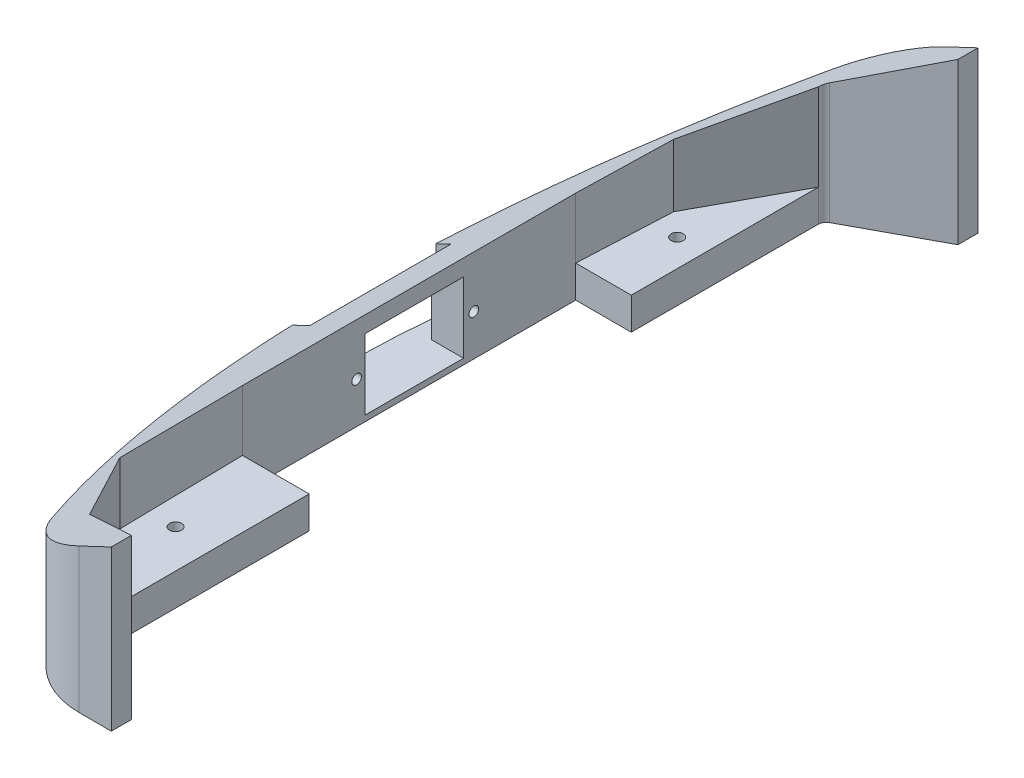
from build123d import *

# Parameters (mm, degrees)
FRONT_SKETCH_R      = 1.905
BOSS_EXTRUDE1_DEPTH = 50.8
CUT_EXTRUDE1_DEPTH  = 40.64
CUT_EXTRUDE2_DEPTH  = 320.68422056
CUT_EXTRUDE3_DEPTH  = 159.197793465
SKETCH6_W           = 6.524310643
SKETCH6_H           = 22.300846009
SKETCH6_R           = 1.524
SKETCH6_W_2         = 6.962786951
BOSS_EXTRUDE2_DEPTH = 10.16


with BuildPart() as part:
    # front_sketch → Boss-Extrude1 (new body)
    with BuildSketch(Plane(origin=(0, 0, 0), x_dir=(1, 0, 0), z_dir=(0, 1, 0))):
        with BuildLine():
            Line((-94.961375831, 124.478458264), (-121.345326632, 110.234521439))
            ThreePointArc((-121.345326632, 110.234521439), (-122.32001306, 109.300728329), (-122.678671172, 107.99944144))
            Line((-122.678671172, 107.99944144), (-122.678671172, 48.810796684))
            Line((-122.678671172, 48.810796684), (-140.250849959, 48.810796684))
            Line((-140.250849959, 48.810796684), (-140.250849959, -56.645199257))
            Line((-140.250849959, -56.645199257), (-119.167015715, -56.645199257))
            Line((-119.167015715, -56.645199257), (-119.167015715, -126.112255785))
            Line((-119.167015715, -126.112255785), (-95.601645083, -136.460242597))
            Line((-95.601645083, -136.460242597), (-95.601645083, -142.810242597))
            Line((-95.601645083, -142.810242597), (-105.798207048, -142.810242597))
            ThreePointArc((-105.798207048, -142.810242597), (-119.167015715, -139.007347839), (-128.532661201, -128.737404395))
            ThreePointArc((-128.532661201, -128.737404395), (-157.286213724, -5.861503432), (-127.918775374, 116.869125935))
            ThreePointArc((-127.918775374, 116.869125935), (-118.556014486, 127.058910858), (-105.241228699, 130.828458264))
            Line((-105.241228699, 130.828458264), (-94.961375831, 130.828458264))
            Line((-94.961375831, 130.828458264), (-94.961375831, 124.478458264))
        make_face()
        with Locations((-131.296368682, 71.963600743)):
            Circle(FRONT_SKETCH_R, mode=Mode.SUBTRACT)
        with Locations((-131.296368682, -86.786399257)):
            Circle(FRONT_SKETCH_R, mode=Mode.SUBTRACT)
    extrude(amount=BOSS_EXTRUDE1_DEPTH)

    # Sketch1 → Cut-Extrude1 (cut)
    with BuildSketch(Plane(origin=(0, 50.8, 0), x_dir=(1, 0, 0), z_dir=(0, 1, 0))):
        Polygon((-122.678671172, 48.810796684), (-122.678671172, 107.99944144), (-138.833286115, 78.405119062), (-140.250849959, 48.810796684), align=None)
        Polygon((-119.167015715, -56.645199257), (-140.250849959, -56.645199257), (-139.542068037, -96.192486205), (-119.167015715, -126.112255785), align=None)
    extrude(amount=-CUT_EXTRUDE1_DEPTH, mode=Mode.SUBTRACT)

    # Sketch3 → Cut-Extrude2 (cut, through all)
    with BuildSketch(Plane.XY.offset(142.810242597)):
        Polygon((-94.961375831, 50.8), (-157.287069608, 21.270817167), (-157.287069608, 50.8), align=None)
    extrude(amount=-CUT_EXTRUDE2_DEPTH, mode=Mode.SUBTRACT)

    # Sketch4 → Cut-Extrude3 (cut, through all)
    with BuildSketch(Plane(origin=(-140.250849959, 0, 0), x_dir=(0, 0, -1), z_dir=(1, 0, 0))):
        Polygon((-24.404629664, 24.144542412), (20.256333242, 24.144542412), (20.256333242, 5.094542412), (20.256333242, 1.843696403), (-24.404629664, 1.843696403), (-24.404629664, 5.094542412), align=None)
    extrude(amount=-CUT_EXTRUDE3_DEPTH, mode=Mode.SUBTRACT)

    # Sketch6 → Boss-Extrude2 (add)
    # profile 1 of 2: a face of its own
    with BuildSketch(Plane(origin=(-140.250849959, 0, 0), x_dir=(0, 0, -1), z_dir=(1, 0, 0))):
        with Locations((-21.142474343, 12.994119407)):
            Rectangle(SKETCH6_W, SKETCH6_H)
        with Locations((-20.530013168, 12.991512488)):
            Circle(SKETCH6_R, mode=Mode.SUBTRACT)
    # profile 2 of 2: a face of its own
    with BuildSketch(Plane(origin=(-140.250849959, 0, 0), x_dir=(0, 0, -1), z_dir=(1, 0, 0))):
        with Locations((16.774939767, 12.994119407)):
            Rectangle(SKETCH6_W_2, SKETCH6_H)
        with Locations((16.553986832, 12.991512488)):
            Circle(SKETCH6_R, mode=Mode.SUBTRACT)
    extrude(amount=-BOSS_EXTRUDE2_DEPTH)


solid = part.part
